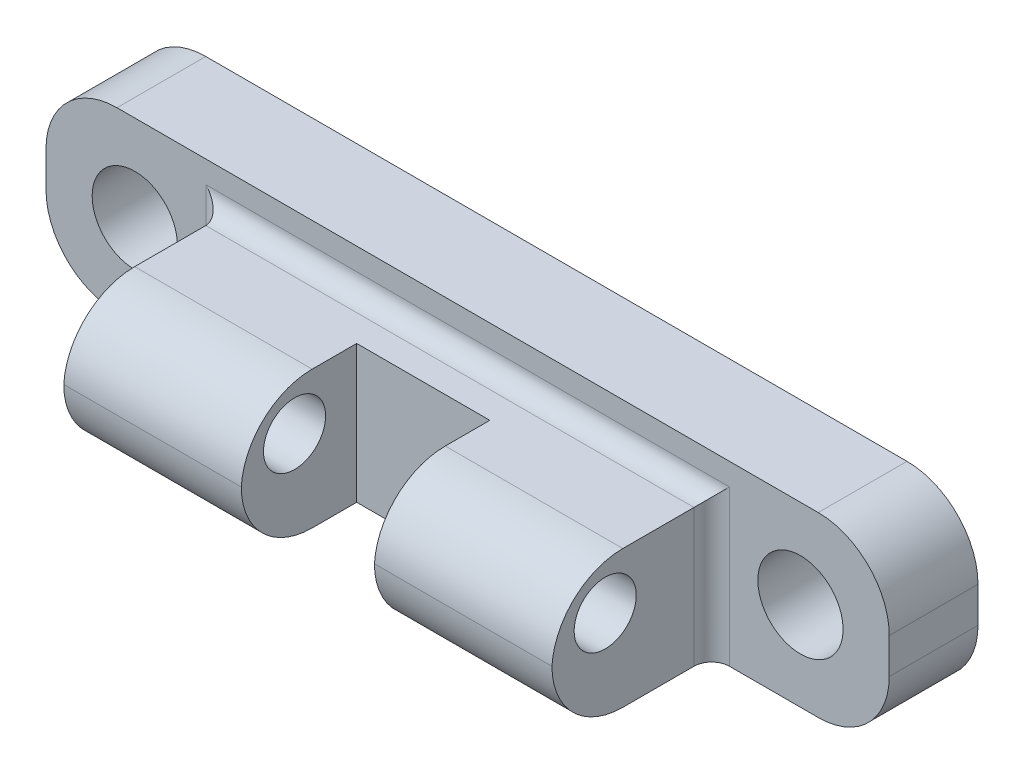
from build123d import *

# Parameters (mm, degrees)
BOSS_EXTRUDE1_DEPTH = 10
SKETCH2_R           = 1.75
CUT_EXTRUDE1_DEPTH  = 30
SKETCH3_R           = 2.4
CUT_EXTRUDE2_DEPTH  = 15.5
FILLET2_R           = 4
FILLET3_R           = 4
SKETCH5_W           = 9
SKETCH5_H           = 2.25
CUT_EXTRUDE3_DEPTH  = 33
FILLET4_R           = 4
FILLET5_R           = 1


with BuildPart() as part:
    # Sketch1 → Boss-Extrude1 (new body)
    with BuildSketch(Plane(origin=(0, 0, 0), x_dir=(1, 0, 0), z_dir=(0, 1, 0))):
        Polygon((17.5, -2.706437242), (27.5, -2.706437242), (27.5, 6.293562758), (37.5, 6.293562758), (37.5, 11.293562758), (-10, 11.293562758), (-10, 6.293562758), (0, 6.293562758), (0, 0), (0, -2.706437242), (10, -2.706437242), (10, 3.793562758), (17.5, 3.793562758), align=None)
    extrude(amount=BOSS_EXTRUDE1_DEPTH)

    # Sketch2 → Cut-Extrude1 (cut, symmetric)
    with BuildSketch(Plane.ZY.offset(-17.5)):
        with Locations((-0.293562758, 5.096871602)):
            Circle(SKETCH2_R)
    extrude(amount=CUT_EXTRUDE1_DEPTH, both=True, mode=Mode.SUBTRACT)

    # Sketch3 → Cut-Extrude2 (cut, symmetric)
    with BuildSketch(Plane.XY.offset(-6.293562758)):
        with Locations(Location((-5, 5, 0), (0, 0, 180))):
            Circle(SKETCH3_R)
        with Locations(Location((32.5, 5, 0), (0, 0, 180))):
            Circle(SKETCH3_R)
    extrude(amount=CUT_EXTRUDE2_DEPTH, both=True, mode=Mode.SUBTRACT)

    # Fillet2
    fillet2_edges = [part.edges().sort_by_distance(p)[0] for p in [
        (22.5, 0, 2.706437242),
        (5, 0, 2.706437242),
    ]]
    fillet(fillet2_edges, radius=FILLET2_R)

    # Fillet3
    fillet3_edges = [part.edges().sort_by_distance(p)[0] for p in [
        (37.5, 10, -8.793562758),
        (-10, 0, -8.793562758),
        (37.5, 0, -8.793562758),
        (-10, 10, -8.793562758),
    ]]
    fillet(fillet3_edges, radius=FILLET3_R)

    # Sketch5 → Cut-Extrude3 (cut, symmetric)
    with BuildSketch(Plane(origin=(27.5, 0, 0), x_dir=(0, 0, -1), z_dir=(1, 0, 0))):
        with Locations((1.793562758, 8.875)):
            Rectangle(SKETCH5_W, SKETCH5_H)
    extrude(amount=CUT_EXTRUDE3_DEPTH, both=True, mode=Mode.SUBTRACT)

    # Fillet4
    # the kernel refuses this fillet: 4 mm, written as the material it takes off along each edge
    with BuildSketch(Plane(origin=(7.519550361, 7.75, 2.706437242), x_dir=(0, 0, -1), z_dir=(1, 0, 0))) as fillet4_piece_1:
        with BuildLine():
            CenterArc((3.992179856, -4), FILLET4_R, 90, 86.416678302)
            Line((0, -3.75), (-0.079843597, -3.745))
            ThreePointArc((-0.079843597, -3.745), (-0.08, -1.875), (-0.08, 0))
            Line((-0.08, 0), (0, 0.08))
            Line((0, 0.08), (3.992179856, 0.08))
            Line((3.992179856, 0.08), (3.992179856, 0))
        make_face()
    extrude(amount=29.960899278, mode=Mode.SUBTRACT)
    with BuildSketch(Plane(origin=(-9.980449639, 7.75, 2.706437242), x_dir=(0, -1, 0), z_dir=(1, 0, 0))) as fillet4_piece_2:
        with BuildLine():
            CenterArc((4, 3.992179856), FILLET4_R, 180, 86.416678302)
            Line((0, 3.992179856), (-0.08, 3.992179856))
            Line((-0.08, 3.992179856), (-0.08, 0))
            Line((-0.08, 0), (0, -0.08))
            ThreePointArc((0, -0.08), (1.875, -0.08), (3.745, -0.079843597))
            Line((3.745, -0.079843597), (3.75, 0))
        make_face()
    extrude(amount=29.960899278, mode=Mode.SUBTRACT)

    # Fillet5
    fillet5_edges = [part.edges().sort_by_distance(p)[0] for p in [
        (27.5, 3.875, -6.293562758),
        (0, 3.875, -6.293562758),
        (13.75, 7.75, -6.293562758),
    ]]
    fillet(fillet5_edges, radius=FILLET5_R)


solid = part.part
